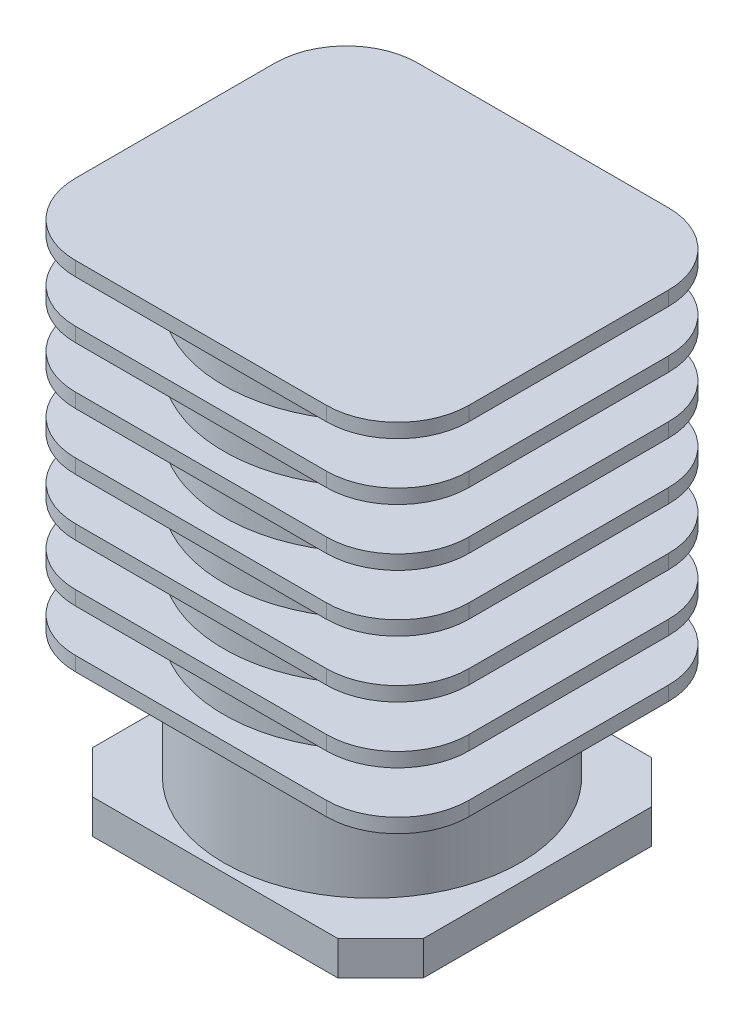
from build123d import *

# Parameters (mm, degrees)
SKETCH1_R           = 52
BOSS_EXTRUDE1_DEPTH = 165
BOSS_EXTRUDE2_DEPTH = 5
LPATTERN1_COUNT     = 7
LPATTERN1_PITCH     = 20
BOSS_EXTRUDE3_DEPTH = 12


with BuildPart() as part:
    # Sketch1 → Boss-Extrude1 (new body)
    with BuildSketch(Plane(origin=(0, 0, 0), x_dir=(1, 0, 0), z_dir=(0, 1, 0))):
        Circle(SKETCH1_R)
    extrude(amount=-BOSS_EXTRUDE1_DEPTH)

    # Sketch2 → Boss-Extrude2 (add)
    with BuildSketch(Plane(origin=(0, 0, 0), x_dir=(1, 0, 0), z_dir=(0, 1, 0))):
        with BuildLine():
            Line((-44, -60), (44, -60))
            ThreePointArc((44, -60), (61.67766953, -52.67766953), (69, -35))
            Line((69, -35), (69, 35))
            ThreePointArc((69, 35), (61.67766953, 52.67766953), (44, 60))
            Line((44, 60), (-44, 60))
            ThreePointArc((-44, 60), (-61.67766953, 52.67766953), (-69, 35))
            Line((-69, 35), (-69, -35))
            ThreePointArc((-69, -35), (-61.67766953, -52.67766953), (-44, -60))
        make_face()
    boss_extrude2 = extrude(amount=-BOSS_EXTRUDE2_DEPTH)

    # LPattern1: Boss-Extrude2 ×7
    with Locations(*[(0, -i * LPATTERN1_PITCH, 0) for i in range(1, LPATTERN1_COUNT)]):
        add(boss_extrude2)

    # Sketch3 → Boss-Extrude3 (add)
    with BuildSketch(Plane.XZ.offset(165)):
        Polygon((-43, 55), (-58, 40), (-58, -40), (-43, -55), (43, -55), (58, -40), (58, 40), (43, 55), align=None)
    extrude(amount=BOSS_EXTRUDE3_DEPTH)


solid = part.part
